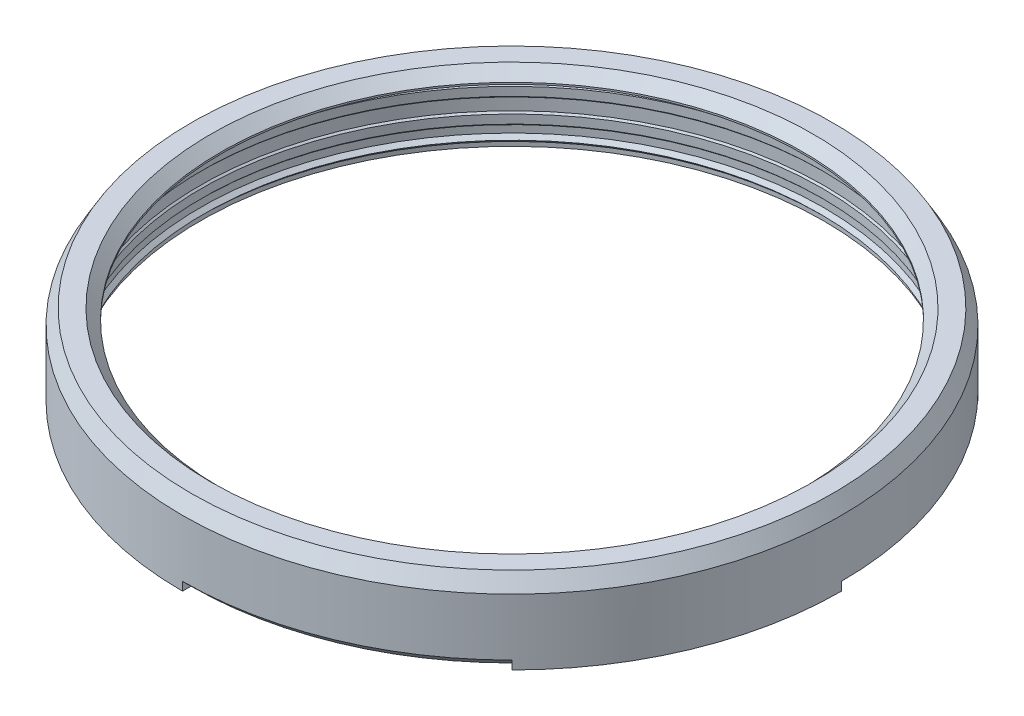
from build123d import *

# Parameters (mm, degrees)
SKETCH_1_R               = 38.5
EXTRUDE_1_DEPTH          = 2
SKETCH_3_R               = 34
CUT_EXTRUDE_1_DEPTH      = 56.357926262
CUT_EXTRUDE_START        = -0.6
SKETCH_4_R               = 38.5
CUT_EXTRUDE_2_DEPTH      = 0.6
CHAMFER_2_SIZE           = 1.2
CUT_REVOLVE_1_ANGLE      = 45
PATTERN_CIRCULAR_1_COUNT = 4
SKETCH_6_R               = 35.28
SKETCH_6_R_2             = 34.82
EXTRUDE_2_DEPTH          = 0.5


with BuildPart() as part:
    # 草图1 → 凸台-拉伸1 (new body)
    with BuildSketch(Plane(origin=(0, 0, 0), x_dir=(1, 0, 0), z_dir=(0, 1, 0))):
        with Locations(Location((0, 0, 0), (0, 0, 270))):
            Circle(SKETCH_1_R)
    extrude(amount=EXTRUDE_1_DEPTH)

    # 草图2 → 旋转1 (revolve)
    with BuildSketch(Plane(origin=(0, 0, 0), x_dir=(0.9335804264972116, 0, -0.3583679495452748), z_dir=(0.3583679495452748, 0, 0.9335804264972116)), mode=Mode.PRIVATE) as revolve_1_sk:
        with BuildLine():
            Line((36.43, -8), (36.43, -7.5))
            Line((36.43, -7.5), (36.005, -7.075))
            Line((36.005, -7.075), (36.43, -6.65))
            Line((36.43, -6.65), (36.43, -5.8))
            Line((36.43, -5.8), (36.24, -5.61))
            Line((36.24, -5.61), (36.24, -4.59))
            Line((36.24, -4.59), (36.43, -4.4))
            Line((36.43, -4.4), (36.43, -3))
            Line((36.43, -3), (36.24, -2.81))
            Line((36.24, -2.81), (36.24, -1.79))
            Line((36.24, -1.79), (36.43, -1.6))
            Line((36.43, -1.6), (36.43, -1.4))
            ThreePointArc((36.43, -1.4), (36.019949494, -0.410050506), (35.03, 0))
            Line((35.03, 0), (38.5, 0))
            Line((38.5, 0), (38.5, -8))
            Line((38.5, -8), (36.43, -8))
        make_face()
    revolve(revolve_1_sk.sketch.rotate(Axis((0, 0, 0), (0, 1, 0)), 69), axis=Axis((0, 0, 0), (0, 1, 0)))

    # 草图3 → 切除-拉伸1 (cut, through all)
    with BuildSketch(Plane(origin=(0, 2, 0), x_dir=(1, 0, 0), z_dir=(0, 1, 0))):
        with Locations(Location((0, 0, 0), (0, 0, 270))):
            Circle(SKETCH_3_R)
    extrude(amount=-CUT_EXTRUDE_1_DEPTH, mode=Mode.SUBTRACT)

    # 草图4 → 切除-拉伸2 (cut)
    with BuildSketch(Plane(origin=(0, 2, 0), x_dir=(1, 0, 0), z_dir=(0, 1, 0)).offset(CUT_EXTRUDE_START)):
        with Locations(Location((0, 0, 0), (0, 0, 90))):
            Circle(SKETCH_4_R)
    extrude(amount=CUT_EXTRUDE_2_DEPTH, mode=Mode.SUBTRACT)

    # 倒角1: read off the stored shape, not the designer's step
    # 倒角1 outline → 倒角1 (revolve, cut)
    with BuildSketch(Plane.XY):
        Polygon((38.5, 1.4), (37.500029334, 1.4), (38.5, -0.332), align=None)
    revolve(axis=Axis((0, 0, 0), (0, 1, 0)), mode=Mode.SUBTRACT)

    # 倒角2
    chamfer_2_edges = [part.edges().sort_by_distance(p)[0] for p in [
        (0, 1.4, -34),
    ]]
    chamfer(chamfer_2_edges, length=CHAMFER_2_SIZE)

    # 草图5 → 切除-旋转1 (revolve, cut)
    with BuildSketch(Plane.XY):
        Polygon((38.5, -8), (38.5, -7), (37.5, -8), align=None)
    cut_revolve_1 = revolve(axis=Axis((0, 0, 0), (0, 1, 0)), revolution_arc=CUT_REVOLVE_1_ANGLE, mode=Mode.SUBTRACT)

    # 阵列(圆周)1: 切除-旋转1 ×4 about axis
    pattern_circular_1_axis = Axis((0, 0, 0), (0, 1, 0))
    for i in range(1, PATTERN_CIRCULAR_1_COUNT):
        add(cut_revolve_1.rotate(pattern_circular_1_axis, i * 360 / PATTERN_CIRCULAR_1_COUNT), mode=Mode.SUBTRACT)

    # 草图6 → 凸台-拉伸2 (add)
    with BuildSketch(Plane.XZ):
        with Locations(Location((0, 0, 0), (0, 0, 270))):
            Circle(SKETCH_6_R)
        with Locations(Location((0, 0, 0), (0, 0, 270))):
            Circle(SKETCH_6_R_2, mode=Mode.SUBTRACT)
    extrude(amount=EXTRUDE_2_DEPTH)


solid = part.part
